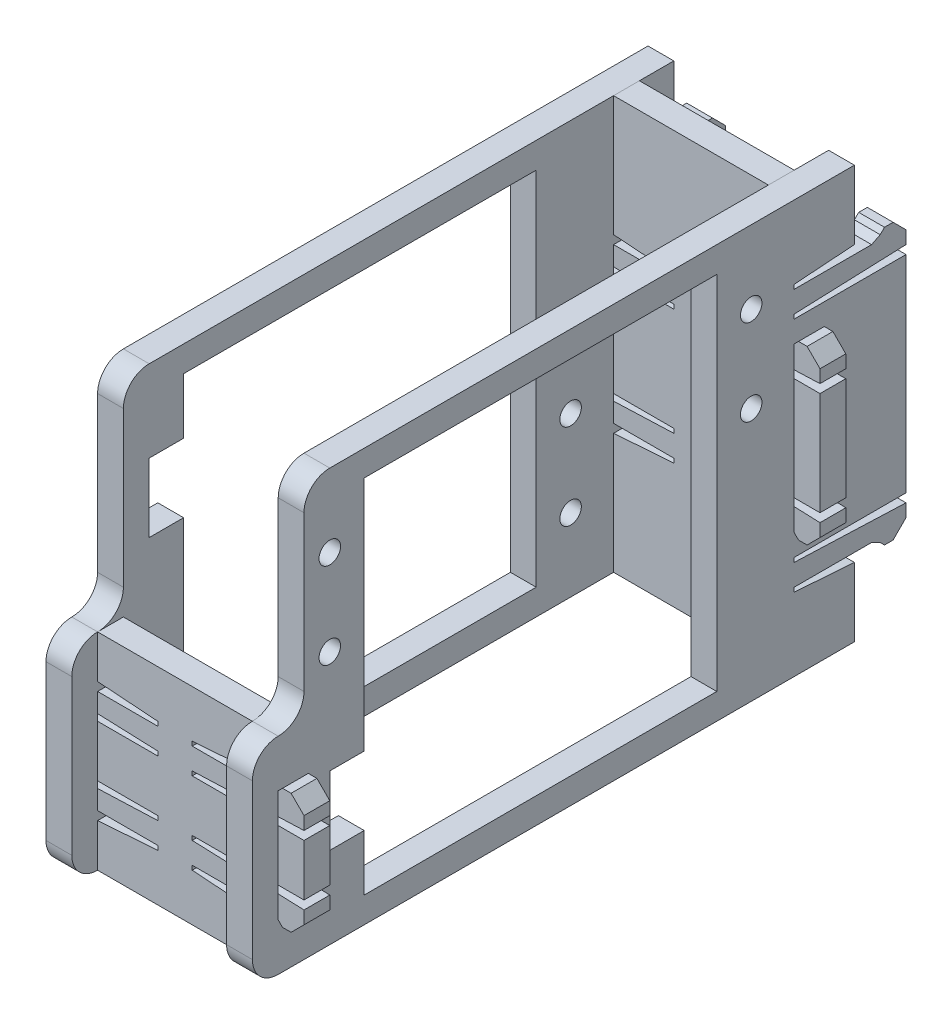
from build123d import *

# Parameters (mm, degrees)
SKETCH1_R           = 1.25
SKETCH1_W           = 3
SKETCH1_H           = 18
BOSS_EXTRUDE1_DEPTH = 3
SKETCH2_R           = 1.25
SKETCH2_W           = 3
SKETCH2_H           = 18
BOSS_EXTRUDE2_DEPTH = 3
BOSS_EXTRUDE3_DEPTH = 3
BOSS_EXTRUDE4_DEPTH = 3
BOSS_EXTRUDE6_DEPTH = 3
BOSS_EXTRUDE7_DEPTH = 3
FILLET1_R           = 3
FILLET2_R           = 3


with BuildPart() as part:
    # Sketch1 → Boss-Extrude1 (new body)
    with BuildSketch(Plane(origin=(9, 0, 0), x_dir=(0, 0, -1), z_dir=(1, 0, 0))):
        Polygon((29.5, 15), (29.5, 15.5), (36.5, 16), (36.5, 24), (-27.5, 24), (-27.5, -24), (36.5, -24), (36.5, -16), (29.5, -15.5), (29.5, -15), (38.5, -15), (39.5, -15.5), (40, -16), (41, -16), (42.5, -14.5), (42.5, -13), (29.5, -12.5), (29.5, -12), (42.5, -12), (42.5, 12), (29.5, 12), (29.5, 12.5), (42.5, 13), (42.5, 14.5), (41, 16), (40, 16), (39.5, 15.5), (38.5, 15), align=None)
        with Locations((-24.5, 15.5)):
            Circle(SKETCH1_R, mode=Mode.SUBTRACT)
        with Locations((-24.5, 5.5)):
            Circle(SKETCH1_R, mode=Mode.SUBTRACT)
        with Locations((24.5, 15.5)):
            Circle(SKETCH1_R, mode=Mode.SUBTRACT)
        with Locations((24.5, 5.5)):
            Circle(SKETCH1_R, mode=Mode.SUBTRACT)
        with Locations((31, 0)):
            Rectangle(SKETCH1_W, SKETCH1_H, mode=Mode.SUBTRACT)
        Polygon((-24.5, -14.5), (-20.5, -14.5), (-20.5, -21), (20.5, -21), (20.5, 21), (-20.5, 21), (-20.5, -6.5), (-24.5, -6.5), align=None, mode=Mode.SUBTRACT)
    extrude(amount=BOSS_EXTRUDE1_DEPTH)

    # Sketch4 → Boss-Extrude4 (add)
    with BuildSketch(Plane(origin=(12, 0, 0), x_dir=(0, 0, -1), z_dir=(1, 0, 0))):
        Polygon((-27.5, -6), (-27.5, 0), (-33.5, 0), (-33.5, -24), (-27.5, -24), (-27.5, -18), (-30.5, -18), (-30.5, -6), align=None)
    extrude(amount=-BOSS_EXTRUDE4_DEPTH)

    # Fillet1
    fillet1_edges = [part.edges().sort_by_distance(p)[0] for p in [
        (10.5, -24, 33.5),
        (10.5, 0, 33.5),
        (10.5, 0, 27.5),
        (10.5, 24, 27.5),
    ]]
    fillet(fillet1_edges, radius=FILLET1_R - 0.0001)  # a hair under: the kernel refuses the full size


with BuildPart() as body_2:
    # Sketch2 → Boss-Extrude2 (new body)
    with BuildSketch(Plane(origin=(-9, 0, 0), x_dir=(0, 0, -1), z_dir=(1, 0, 0))):
        Polygon((42.5, -12), (29.5, -12), (29.5, -12.5), (42.5, -13), (42.5, -14.5), (41, -16), (40, -16), (39.5, -15.5), (38.5, -15), (29.5, -15), (29.5, -15.5), (36.5, -16), (36.5, -24), (-27.5, -24), (-27.5, 24), (36.5, 24), (36.5, 16), (29.5, 15.5), (29.5, 15), (38.5, 15), (39.5, 15.5), (40, 16), (41, 16), (42.5, 14.5), (42.5, 13), (29.5, 12.5), (29.5, 12), (42.5, 12), align=None)
        with Locations((-24.5, -5.5)):
            Circle(SKETCH2_R, mode=Mode.SUBTRACT)
        with Locations((-24.5, -15.5)):
            Circle(SKETCH2_R, mode=Mode.SUBTRACT)
        with Locations((24.5, -15.5)):
            Circle(SKETCH2_R, mode=Mode.SUBTRACT)
        with Locations((24.5, -5.5)):
            Circle(SKETCH2_R, mode=Mode.SUBTRACT)
        Polygon((-20.5, 6.5), (-20.5, -21), (20.5, -21), (20.5, 21), (-20.5, 21), (-20.5, 14.5), (-24.5, 14.5), (-24.5, 6.5), align=None, mode=Mode.SUBTRACT)
        with Locations((31, 0)):
            Rectangle(SKETCH2_W, SKETCH2_H, mode=Mode.SUBTRACT)
    extrude(amount=-BOSS_EXTRUDE2_DEPTH)

    # Sketch5 → Boss-Extrude6 (add)
    with BuildSketch(Plane.ZY.offset(12)):
        Polygon((33.5, 0), (27.5, 0), (27.5, -6), (30.5, -6), (30.5, -18), (27.5, -18), (27.5, -24), (33.5, -24), align=None)
    extrude(amount=-BOSS_EXTRUDE6_DEPTH)

    # Fillet2
    fillet2_edges = [body_2.edges().sort_by_distance(p)[0] for p in [
        (-10.5, -24, 33.5),
        (-10.5, 0, 33.5),
        (-10.5, 0, 27.5),
        (-10.5, 24, 27.5),
    ]]
    fillet(fillet2_edges, radius=FILLET2_R - 0.0001)  # a hair under: the kernel refuses the full size


with BuildPart() as body_3:
    # Sketch3 → Boss-Extrude3 (new body)
    with BuildSketch(Plane(origin=(0, 0, -29.5), x_dir=(-1, 0, 0), z_dir=(0, 0, -1))):
        Polygon((9, -10), (9, -24), (-9, -24), (-9, -10), (-2, -9.5), (-2, -9), (-11, -9), (-12, -9.5), (-12.5, -10), (-13.5, -10), (-15, -8.5), (-15, -7), (-2, -6.5), (-2, -6), (-15, -6), (-15, 6), (-2, 6), (-2, 6.5), (-15, 7), (-15, 8.5), (-13.5, 10), (-12.5, 10), (-12, 9.5), (-11, 9), (-2, 9), (-2, 9.5), (-9, 10), (-9, 24), (9, 24), (9, 10), (2, 9.5), (2, 9), (11, 9), (12, 9.5), (12.5, 10), (13.5, 10), (15, 8.5), (15, 7), (2, 6.5), (2, 6), (15, 6), (15, -6), (2, -6), (2, -6.5), (15, -7), (15, -8.5), (13.5, -10), (12.5, -10), (12, -9.5), (11, -9), (2, -9), (2, -9.5), align=None)
    extrude(amount=BOSS_EXTRUDE3_DEPTH)


with BuildPart() as body_4:
    # Sketch6 → Boss-Extrude7 (new body)
    with BuildSketch(Plane.XY.offset(27.5)):
        Polygon((15, -9), (15, -15), (2, -15), (2, -15.5), (15, -16), (15, -17.5), (13.5, -19), (12.5, -19), (12, -18.5), (11, -18), (2, -18), (2, -18.5), (9, -19), (9, -24), (-9, -24), (-9, -19), (-2, -18.5), (-2, -18), (-11, -18), (-12, -18.5), (-12.5, -19), (-13.5, -19), (-15, -17.5), (-15, -16), (-2, -15.5), (-2, -15), (-15, -15), (-15, -9), (-2, -9), (-2, -8.5), (-15, -8), (-15, -6.5), (-13.5, -5), (-12.5, -5), (-12, -5.5), (-11, -6), (-2, -6), (-2, -5.5), (-9, -5), (-9, 0), (9, 0), (9, -5), (2, -5.5), (2, -6), (11, -6), (12, -5.5), (12.5, -5), (13.5, -5), (15, -6.5), (15, -8), (2, -8.5), (2, -9), align=None)
    extrude(amount=BOSS_EXTRUDE7_DEPTH)


solid = Compound([part.part, body_2.part, body_3.part, body_4.part])
